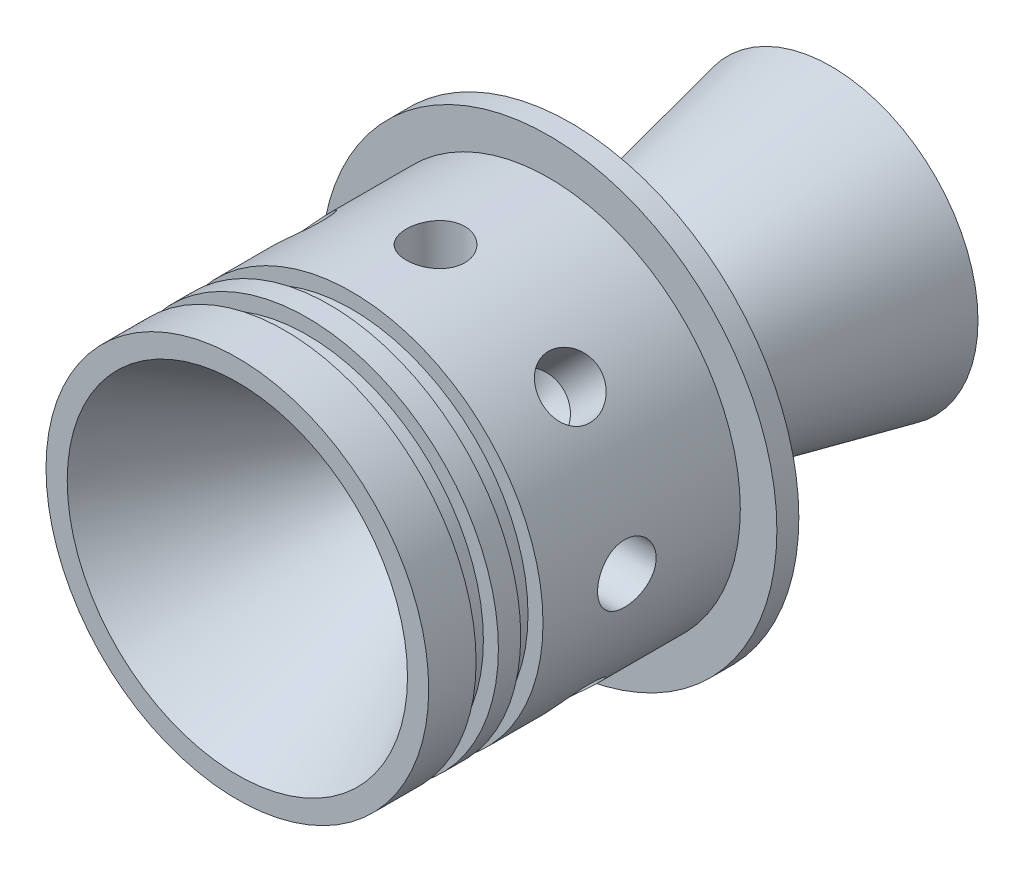
from build123d import *

# Parameters (mm, degrees)
MATRIZC1_COUNT = 8


with BuildPart() as part:
    # Croquis2 → Revolución1 (revolve)
    with BuildSketch(Plane(origin=(0, 0, 0), x_dir=(0, 0, -1), z_dir=(1, 0, 0))):
        Polygon((0, 23.2509), (28.580397171, 6.75), (30.580397171, 6.75), (81.155170848, 17.5), (81.155170848, 20.055851487), (45.580397171, 12.494199912), (45.580397171, 26.0993), (45.580397171, 31.1493), (42.580397171, 31.1493), (42.580397171, 26.1493), (15.62, 26.1493), (15.62, 24.0993), (12.572, 24.0993), (12.572, 26.1493), (9.524, 26.1493), (9.524, 24.0993), (6.476, 24.0993), (6.476, 26.1493), (0, 26.1493), align=None)
    revolve(axis=Axis((0, 0, 14.017218159), (0, 0, -1)))

    # Croquis5 → Ø8.0mm Dowel Hole1 (revolve, cut)
    with BuildSketch(Plane(origin=(0, 26.1493, -27.080397171), x_dir=(0, 0, 1), z_dir=(1, 0, 0))):
        Polygon((0, 0), (0, 9.403442476), (4, 7), (4, 0), align=None)
    f_8_0mm_dowel_hole1 = revolve(axis=Axis((0, 32.4993, -27.080397171), (0, -1, 0)), mode=Mode.SUBTRACT)

    # MatrizC1: Ø8.0mm Dowel Hole1 ×8 about axis
    matrizc1_axis = Axis((0, 0, -15.62), (0, 0, 1))
    for i in range(1, MATRIZC1_COUNT):
        add(f_8_0mm_dowel_hole1.rotate(matrizc1_axis, i * 360 / MATRIZC1_COUNT), mode=Mode.SUBTRACT)


solid = part.part
